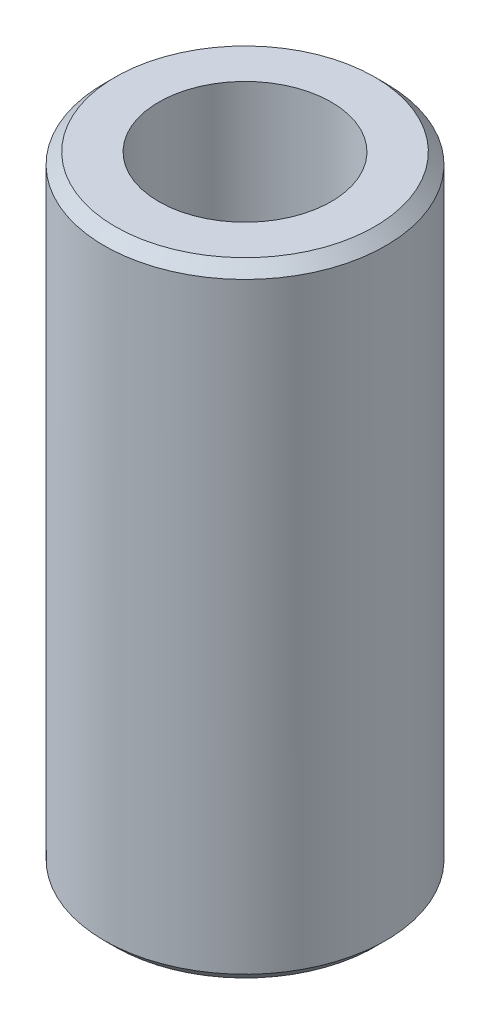
from build123d import *

# Parameters (mm, degrees)
SKETCH1_R           = 50
BOSS_EXTRUDE1_DEPTH = 221.681637072
SKETCH2_R           = 30.654489111
CUT_EXTRUDE1_DEPTH  = 233.685943312
CHAMFER1_SIZE       = 3.927947958


with BuildPart() as part:
    # Sketch1 → Boss-Extrude1 (new body)
    with BuildSketch(Plane(origin=(0, 0, 0), x_dir=(1, 0, 0), z_dir=(0, 1, 0))):
        Circle(SKETCH1_R)
    extrude(amount=BOSS_EXTRUDE1_DEPTH)

    # Sketch2 → Cut-Extrude1 (cut, through all)
    with BuildSketch(Plane(origin=(0, 0, 0), x_dir=(1, 0, 0), z_dir=(0, 1, 0))):
        Circle(SKETCH2_R)
    extrude(amount=CUT_EXTRUDE1_DEPTH, mode=Mode.SUBTRACT)

    # Chamfer1
    chamfer1_edges = [part.edges().sort_by_distance(p)[0] for p in [
        (-50, 221.681637072, 0),
        (-50, 0, 0),
    ]]
    chamfer(chamfer1_edges, length=CHAMFER1_SIZE)


solid = part.part
